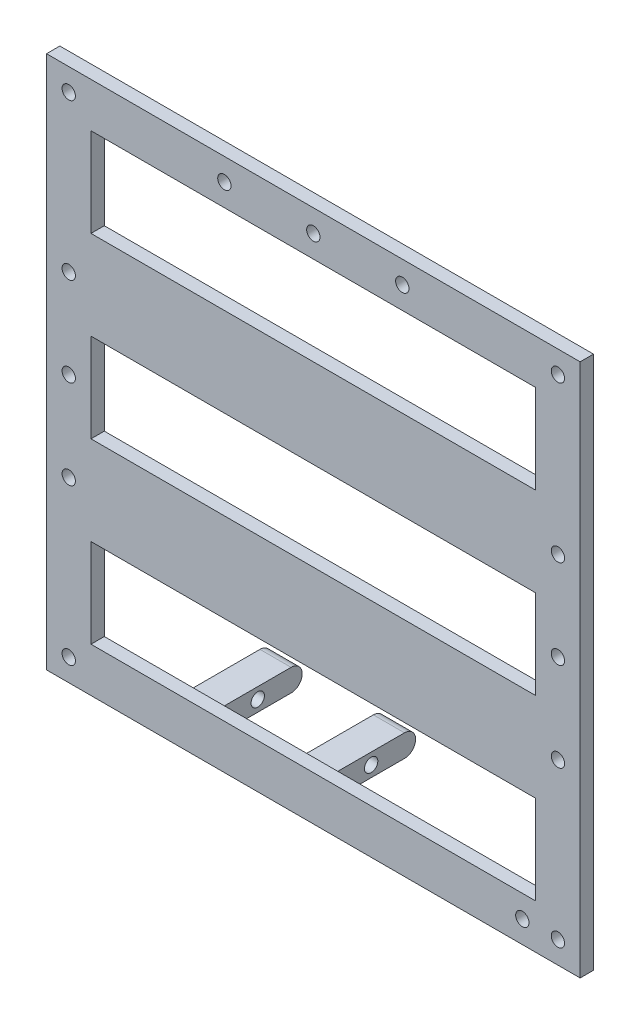
from build123d import *

# Parameters (mm, degrees)
ESBO_O1_W                = 120
ESBO_O1_H                = 120
RESSALTO_EXTRUS_O1_DEPTH = 3
ESBO_O2_W                = 100
ESBO_O2_H                = 100
CORTE_EXTRUS_O1_DEPTH    = 161.631068924
ESBO_O5_W                = 7
ESBO_O5_H                = 5
RESSALTO_EXTRUS_O2_DEPTH = 20
ESBO_O6_R                = 1.5
CORTE_EXTRUS_O2_DEPTH    = 10
ESBO_O7_R                = 1.5
CORTE_EXTRUS_O3_DEPTH    = 162.843567384
ESBO_O8_R                = 1.5
CORTE_EXTRUS_O4_DEPTH    = 148.896743526
FILETE2_R                = 2.5
ESBO_O9_W                = 100
ESBO_O9_H                = 20
RESSALTO_EXTRUS_O3_DEPTH = 3
ESBO_O10_R               = 1.5
CORTE_EXTRUS_O5_DEPTH    = 10


with BuildPart() as part:
    # Esboço1 → Ressalto-extrusão1 (new body)
    with BuildSketch(Plane.XY):
        with Locations((53.473096186, -53.653846154)):
            Rectangle(ESBO_O1_W, ESBO_O1_H)
    extrude(amount=RESSALTO_EXTRUS_O1_DEPTH)

    # Esboço2 → Corte-extrusão1 (cut, through all)
    with BuildSketch(Plane.XY.offset(3)):
        with Locations((53.473096186, -53.653846154)):
            Rectangle(ESBO_O2_W, ESBO_O2_H)
    extrude(amount=-CORTE_EXTRUS_O1_DEPTH, mode=Mode.SUBTRACT)

    # Esboço5 → Ressalto-extrusão2 (add)
    with BuildSketch(Plane(origin=(0, 0, 0), x_dir=(-1, 0, 0), z_dir=(0, 0, -1))):
        with Locations((-49.973096186, -108.653846154)):
            Rectangle(ESBO_O5_W, ESBO_O5_H)
        with Locations((-24.473096186, -108.653846154)):
            Rectangle(ESBO_O5_W, ESBO_O5_H)
    extrude(amount=RESSALTO_EXTRUS_O2_DEPTH)

    # Esboço6 → Corte-extrusão2 (cut)
    with BuildSketch(Plane(origin=(0, 0, 0), x_dir=(-1, 0, 0), z_dir=(0, 0, -1))):
        with Locations((1.526903814, -108.653846154)):
            Circle(ESBO_O6_R)
        with Locations((1.526903814, -73.653846154)):
            Circle(ESBO_O6_R)
        with Locations((1.526903814, -53.653846154)):
            Circle(ESBO_O6_R)
        with Locations((1.526903814, -33.653846154)):
            Circle(ESBO_O6_R)
        with Locations((1.526903814, 1.346153846)):
            Circle(ESBO_O6_R)
        with Locations(Location((-108.473096186, 1.346153846, 0), (0, 0, 180))):
            Circle(ESBO_O6_R)
        with Locations(Location((-108.473096186, -33.653846154, 0), (0, 0, 180))):
            Circle(ESBO_O6_R)
        with Locations(Location((-108.473096186, -53.653846154, 0), (0, 0, 180))):
            Circle(ESBO_O6_R)
        with Locations(Location((-108.473096186, -73.653846154, 0), (0, 0, 180))):
            Circle(ESBO_O6_R)
        with Locations(Location((-108.473096186, -108.653846154, 0), (0, 0, 180))):
            Circle(ESBO_O6_R)
    extrude(amount=-CORTE_EXTRUS_O2_DEPTH, mode=Mode.SUBTRACT)

    # Esboço7 → Corte-extrusão3 (cut, through all)
    with BuildSketch(Plane(origin=(0, 0, 0), x_dir=(-1, 0, 0), z_dir=(0, 0, -1))):
        with Locations((-100.473096186, -108.653846154)):
            Circle(ESBO_O7_R)
    extrude(amount=-CORTE_EXTRUS_O3_DEPTH, mode=Mode.SUBTRACT)

    # Esboço8 → Corte-extrusão4 (cut, through all)
    with BuildSketch(Plane.ZY.offset(-20.973096186)):
        with Locations((-10, -108.653846154)):
            Circle(ESBO_O8_R)
    extrude(amount=-CORTE_EXTRUS_O4_DEPTH, mode=Mode.SUBTRACT)

    # Filete2
    filete2_edges = [part.edges().sort_by_distance(p)[0] for p in [
        (49.973096186, -106.153846154, 0),
        (49.973096186, -106.153846154, -20),
        (49.973096186, -111.153846154, -20),
        (46.473096186, -108.653846154, 0),
        (53.473096186, -108.653846154, 0),
        (49.973096186, -111.153846154, 0),
        (24.473096186, -106.153846154, -20),
        (24.473096186, -111.153846154, -20),
        (24.473096186, -106.153846154, 0),
        (27.973096186, -108.653846154, 0),
        (24.473096186, -111.153846154, 0),
        (20.973096186, -108.653846154, 0),
    ]]
    fillet(filete2_edges, radius=FILETE2_R - 0.0001)  # a hair under: the kernel refuses the full size

    # Esboço9 → Ressalto-extrusão3 (add)
    with BuildSketch(Plane(origin=(0, 0, 0), x_dir=(-1, 0, 0), z_dir=(0, 0, -1))):
        with Locations((-53.473096186, -73.653846154)):
            Rectangle(ESBO_O9_W, ESBO_O9_H)
        with Locations((-53.473096186, -33.653846154)):
            Rectangle(ESBO_O9_W, ESBO_O9_H)
    extrude(amount=-RESSALTO_EXTRUS_O3_DEPTH)

    # Esboço10 → Corte-extrusão5 (cut)
    with BuildSketch(Plane(origin=(0, 0, 0), x_dir=(-1, 0, 0), z_dir=(0, 0, -1))):
        with Locations((-33.473096186, 1.346153846)):
            Circle(ESBO_O10_R)
        with Locations((-53.473096186, 1.346153846)):
            Circle(ESBO_O10_R)
        with Locations((-73.473096186, 1.346153846)):
            Circle(ESBO_O10_R)
    extrude(amount=-CORTE_EXTRUS_O5_DEPTH, mode=Mode.SUBTRACT)


solid = part.part
